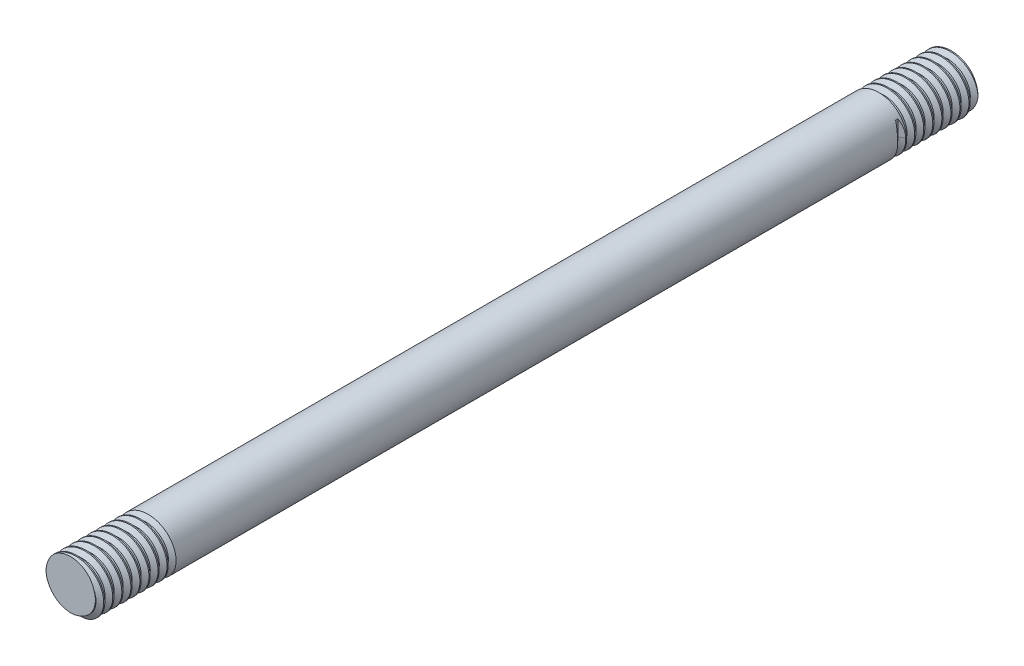
from build123d import *

# Parameters (mm, degrees)
SKETCH2_R           = 3
BOSS_EXTRUDE1_DEPTH = 48.5
THREAD1_PITCH       = 1
THREAD2_PITCH       = 1
CUT_EXTRUDE1_DEPTH  = 97
CUT_EXTRUDE2_DEPTH  = 97


with BuildPart() as part:
    # Sketch2 → Boss-Extrude1 (new, symmetric)
    with BuildSketch(Plane.XY):
        with Locations(Location((0, 0, 0), (0, 0, 180))):
            Circle(SKETCH2_R)
    extrude(amount=BOSS_EXTRUDE1_DEPTH, both=True)

    # Thread1: the profile of Thread Profile1 profile screwed along a right-hand helix of 9 turns, 8 arcs to a turn; built about Z, then put on its axis
    thread1_z = Axis((0, 0, 0), (0, 0, 1))
    thread1_corners = [(3.0003, 0, -0.000173205), (3.0003, 0, 0.875173202), (2.458734125, 0, 0.562499999), (2.458734125, 0, 0.312499999)]
    with BuildLine(mode=Mode.PRIVATE) as thread1_profile:
        Line(thread1_corners[0], thread1_corners[1])
        Line(thread1_corners[1], thread1_corners[2])
        Line(thread1_corners[2], thread1_corners[3])
        Line(thread1_corners[3], thread1_corners[0])
    thread1_cap = Face(thread1_profile.wire())
    thread1_turn_angles = [0, 22.5, 45, 67.5, 90, 112.5, 135, 157.5, 180, 202.5, 225, 247.5, 270, 292.5, 315, 337.5, 360]
    thread1_turn_weights = [1, 0.9238795325112867, 1, 0.9238795325112867, 1, 0.9238795325112867, 1, 0.9238795325112867, 1, 0.9238795325112867, 1, 0.9238795325112867, 1, 0.9238795325112867, 1, 0.9238795325112867, 1]
    thread1_turn_rails = [Edge.make_bspline([Vector(p[0], p[1], 0).rotate(thread1_z, thread1_turn_angles[k]) / thread1_turn_weights[k] + Vector(0, 0, p[2] + THREAD1_PITCH * thread1_turn_angles[k] / 360) for k in range(17)], [0, 0, 0, 1, 1, 2, 2, 3, 3, 4, 4, 5, 5, 6, 6, 7, 7, 8, 8, 8], 2, thread1_turn_weights) for p in thread1_corners]
    thread1_turn_sides = [Face.make_surface_from_curves(thread1_turn_rails[p[0]], thread1_turn_rails[p[1]]) for p in [(0, 1), (1, 2), (2, 3), (3, 0)]]
    thread1 = Plane(origin=(0, 0, 49.5), x_dir=(-1, 0, 0), z_dir=(0, 0, -1)) * Solid(Shell([*[p.moved(Location((0, 0, THREAD1_PITCH * i))) for i in range(9) for p in thread1_turn_sides], thread1_cap, thread1_cap.rotate(thread1_z, 3240).moved(Location((0, 0, THREAD1_PITCH * 3240 / 360)))]))
    add(thread1, mode=Mode.SUBTRACT)

    # Thread2: the profile of Thread Profile2 profile screwed along a right-hand helix of 9 turns, 8 arcs to a turn; built about Z, then put on its axis
    thread2_z = Axis((0, 0, 0), (0, 0, 1))
    thread2_corners = [(3.0003, 0, -0.000173205), (3.0003, 0, 0.875173202), (2.458734125, 0, 0.562499999), (2.458734125, 0, 0.312499999)]
    with BuildLine(mode=Mode.PRIVATE) as thread2_profile:
        Line(thread2_corners[0], thread2_corners[1])
        Line(thread2_corners[1], thread2_corners[2])
        Line(thread2_corners[2], thread2_corners[3])
        Line(thread2_corners[3], thread2_corners[0])
    thread2_cap = Face(thread2_profile.wire())
    thread2_turn_angles = [0, 22.5, 45, 67.5, 90, 112.5, 135, 157.5, 180, 202.5, 225, 247.5, 270, 292.5, 315, 337.5, 360]
    thread2_turn_weights = [1, 0.9238795325112867, 1, 0.9238795325112867, 1, 0.9238795325112867, 1, 0.9238795325112867, 1, 0.9238795325112867, 1, 0.9238795325112867, 1, 0.9238795325112867, 1, 0.9238795325112867, 1]
    thread2_turn_rails = [Edge.make_bspline([Vector(p[0], p[1], 0).rotate(thread2_z, thread2_turn_angles[k]) / thread2_turn_weights[k] + Vector(0, 0, p[2] + THREAD2_PITCH * thread2_turn_angles[k] / 360) for k in range(17)], [0, 0, 0, 1, 1, 2, 2, 3, 3, 4, 4, 5, 5, 6, 6, 7, 7, 8, 8, 8], 2, thread2_turn_weights) for p in thread2_corners]
    thread2_turn_sides = [Face.make_surface_from_curves(thread2_turn_rails[p[0]], thread2_turn_rails[p[1]]) for p in [(0, 1), (1, 2), (2, 3), (3, 0)]]
    thread2 = Plane(origin=(0, 0, -49.5), x_dir=(1, 0, 0), z_dir=(0, 0, 1)) * Solid(Shell([*[p.moved(Location((0, 0, THREAD2_PITCH * i))) for i in range(9) for p in thread2_turn_sides], thread2_cap, thread2_cap.rotate(thread2_z, 3240).moved(Location((0, 0, THREAD2_PITCH * 3240 / 360)))]))
    add(thread2, mode=Mode.SUBTRACT)

    # Sketch11 → Cut-Extrude1 (cut)
    with BuildSketch(Plane.XZ):
        Polygon((2.458734125, -40.187500001), (3, -40.5), (3, -39.625000003), (2.458734125, -39.937500001), align=None)
    extrude(amount=-CUT_EXTRUDE1_DEPTH, mode=Mode.SUBTRACT)

    # Sketch12 → Cut-Extrude2 (cut)
    with BuildSketch(Plane.XZ):
        Polygon((-2.458734125, 40.187500001), (-3, 40.5), (-3, 39.625000003), (-2.458734125, 39.937500001), align=None)
    extrude(amount=-CUT_EXTRUDE2_DEPTH, mode=Mode.SUBTRACT)


solid = part.part
